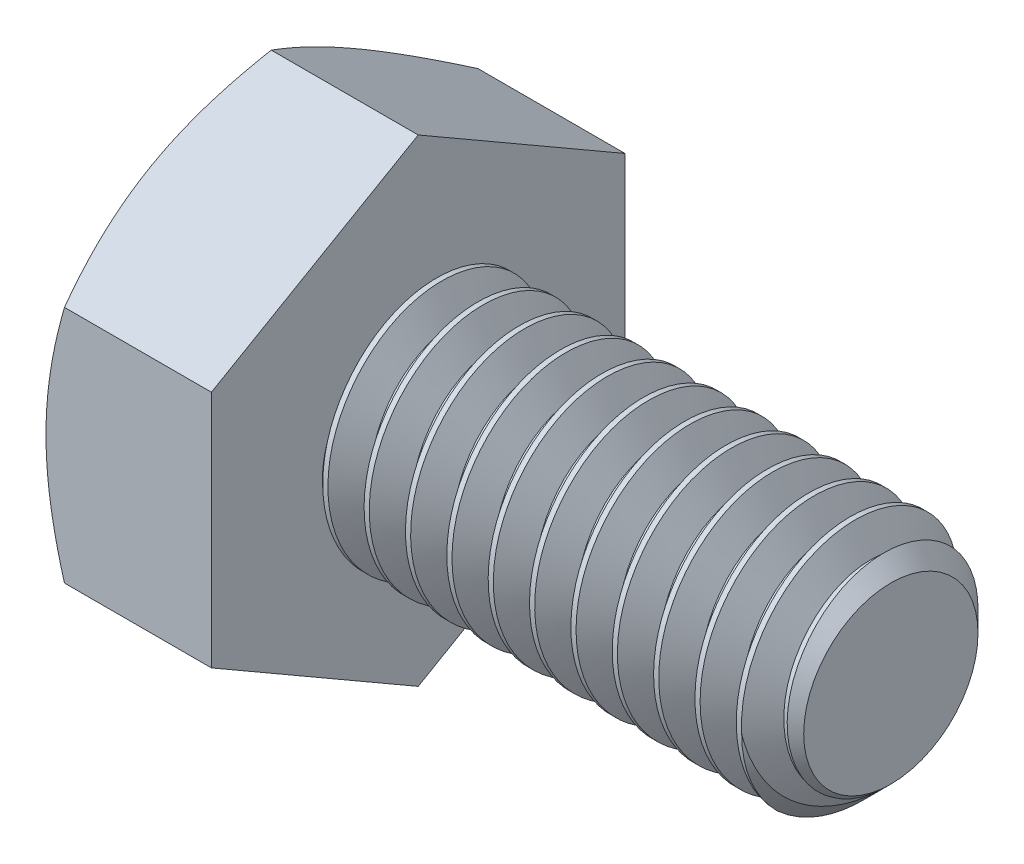
from build123d import *

# Parameters (mm, degrees)
SKETCH2_R           = 2
BOSS_EXTRUDE1_DEPTH = 8
CHAMFER1_SIZE       = 0.525
CUT_SWEEP1_PITCH    = 0.7
BOSS_EXTRUDE2_DEPTH = 2.8
SKETCH6_OUTSIDE_W   = 57.25
SKETCH6_OUTSIDE_H   = 58.332
SKETCH6_OUTSIDE_R   = 3.5
CUT_EXTRUDE1_DEPTH  = 13.050864575
CUT_EXTRUDE1_DRAFT  = -60


with BuildPart() as part:
    # Sketch2 → Boss-Extrude1 (new body)
    with BuildSketch(Plane(origin=(5.4, 0, 0), x_dir=(0, 0, -1), z_dir=(1, 0, 0))):
        Circle(SKETCH2_R)
    extrude(amount=-BOSS_EXTRUDE1_DEPTH)

    # Chamfer1
    chamfer1_edges = [part.edges().sort_by_distance(p)[0] for p in [
        (5.4, 0, 2),
    ]]
    chamfer(chamfer1_edges, length=CHAMFER1_SIZE)

    # Cut-Sweep1: the profile of Sketch5 profile screwed along a right-hand helix of 12.428571 turns, 6 arcs to a turn; built about Z, then put on its axis
    cut_sweep1_z = Axis((0, 0, 0), (0, 0, 1))
    cut_sweep1_corners = [(2.0003, 0, 0.000173205), (1.545336663, 0, -0.2625), (1.545336663, 0, -0.35), (2.0003, 0, -0.612673205)]
    with BuildLine(mode=Mode.PRIVATE) as cut_sweep1_profile:
        Line(cut_sweep1_corners[0], cut_sweep1_corners[1])
        Line(cut_sweep1_corners[1], cut_sweep1_corners[2])
        Line(cut_sweep1_corners[2], cut_sweep1_corners[3])
        Line(cut_sweep1_corners[3], cut_sweep1_corners[0])
    cut_sweep1_cap = Face(cut_sweep1_profile.wire())
    cut_sweep1_turn_angles = [0, 30, 60, 90, 120, 150, 180, 210, 240, 270, 300, 330, 360]
    cut_sweep1_turn_weights = [1, 0.8660254037844387, 1, 0.8660254037844387, 1, 0.8660254037844387, 1, 0.8660254037844387, 1, 0.8660254037844387, 1, 0.8660254037844387, 1]
    cut_sweep1_turn_rails = [Edge.make_bspline([Vector(p[0], p[1], 0).rotate(cut_sweep1_z, cut_sweep1_turn_angles[k]) / cut_sweep1_turn_weights[k] + Vector(0, 0, p[2] + CUT_SWEEP1_PITCH * cut_sweep1_turn_angles[k] / 360) for k in range(13)], [0, 0, 0, 1, 1, 2, 2, 3, 3, 4, 4, 5, 5, 6, 6, 6], 2, cut_sweep1_turn_weights) for p in cut_sweep1_corners]
    cut_sweep1_turn_sides = [Face.make_surface_from_curves(cut_sweep1_turn_rails[p[0]], cut_sweep1_turn_rails[p[1]]) for p in [(0, 1), (1, 2), (2, 3), (3, 0)]]
    cut_sweep1_last_angles = [4320, 4350, 4380, 4410, 4440, 4457.142857143, 4474.285714286]
    cut_sweep1_last_weights = [1, 0.8660254037844387, 1, 0.8660254037844387, 1, 0.9555728057861561, 1]
    cut_sweep1_last_rails = [Edge.make_bspline([Vector(p[0], p[1], 0).rotate(cut_sweep1_z, cut_sweep1_last_angles[k]) / cut_sweep1_last_weights[k] + Vector(0, 0, p[2] + CUT_SWEEP1_PITCH * cut_sweep1_last_angles[k] / 360) for k in range(7)], [0, 0, 0, 1, 1, 2, 2, 3, 3, 3], 2, cut_sweep1_last_weights) for p in cut_sweep1_corners]
    cut_sweep1_last_sides = [Face.make_surface_from_curves(cut_sweep1_last_rails[p[0]], cut_sweep1_last_rails[p[1]]) for p in [(0, 1), (1, 2), (2, 3), (3, 0)]]
    cut_sweep1 = Plane(origin=(5.4, 0, 0), x_dir=(0, 1, 0), z_dir=(-1, 0, 0)) * Solid(Shell([*[p.moved(Location((0, 0, CUT_SWEEP1_PITCH * i))) for i in range(12) for p in cut_sweep1_turn_sides], *cut_sweep1_last_sides, cut_sweep1_cap, cut_sweep1_cap.rotate(cut_sweep1_z, 4474.285714286).moved(Location((0, 0, CUT_SWEEP1_PITCH * 4474.285714286 / 360)))]))
    add(cut_sweep1, mode=Mode.SUBTRACT)

    # Sketch3 → Boss-Extrude2 (add)
    with BuildSketch(Plane.ZY.offset(2.6)):
        Polygon((-3.5, -2.020725942), (0, -4.041451884), (3.5, -2.020725942), (3.5, 2.020725942), (0, 4.041451884), (-3.5, 2.020725942), align=None)
    extrude(amount=BOSS_EXTRUDE2_DEPTH)


with BuildPart() as cut_extrude1_tool:
    # Sketch6 outside → Cut-Extrude1 (with draft: the straight prism first)
    with BuildSketch(Plane.ZY.offset(5.4)):
        Rectangle(SKETCH6_OUTSIDE_W, SKETCH6_OUTSIDE_H)
        Circle(SKETCH6_OUTSIDE_R, mode=Mode.SUBTRACT)
    extrude(amount=-CUT_EXTRUDE1_DEPTH)
    # Cut-Extrude1: the draft: its side faces are tilted about the plane it starts from
    cut_extrude1_sides = [cut_extrude1_tool.faces().sort_by_distance(p)[0] for p in [
        (1.125432287, -29.166, 0),
        (1.125432287, 0, 28.625),
        (1.125432287, 29.166, 0),
        (1.125432287, 0, -28.625),
        (1.125432287, 0, -3.5),
    ]]
    draft(cut_extrude1_sides, Plane.ZY.offset(5.4), CUT_EXTRUDE1_DRAFT)


with BuildPart() as part_1:
    add(part.part)

    # Cut-Extrude1: cut by cut_extrude1_tool
    add(cut_extrude1_tool.part, mode=Mode.SUBTRACT)


solid = part_1.part
